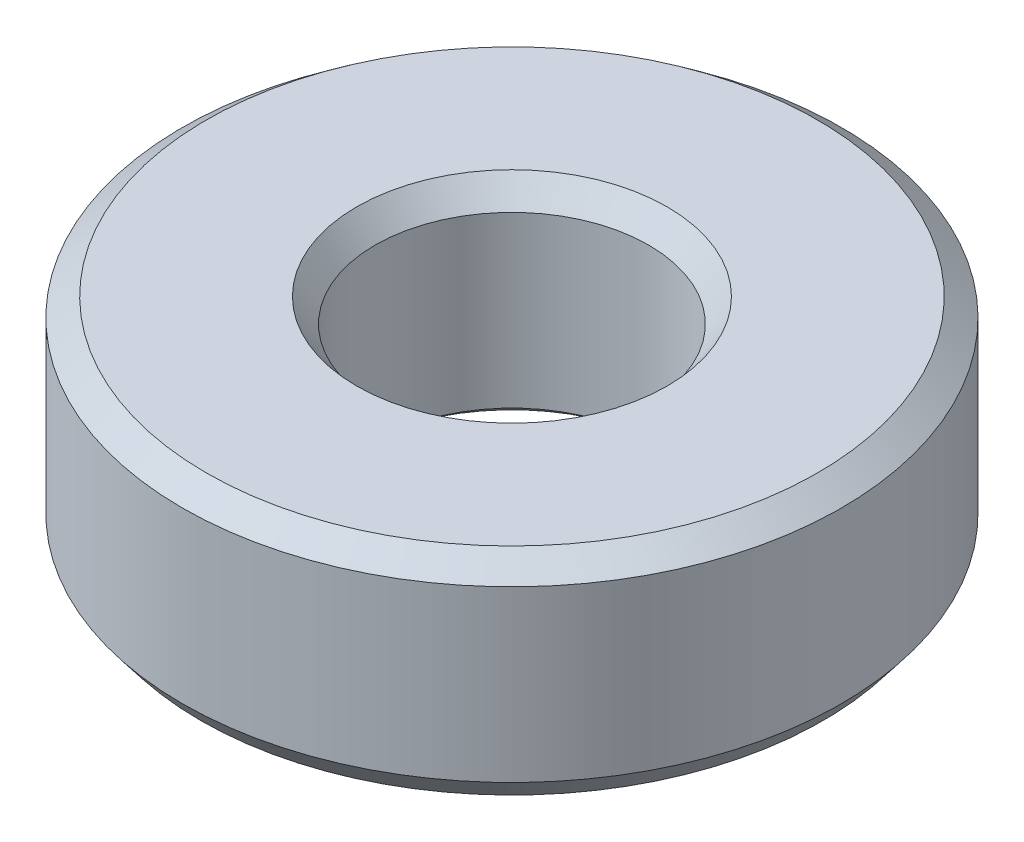
from build123d import *
from OCP.BRepFilletAPI import BRepFilletAPI_MakeChamfer

# Parameters (mm, degrees)
SKETCH1_R           = 17.5
BOSS_EXTRUDE1_DEPTH = 11.24791048
SKETCH2_R           = 7.264637679
CUT_EXTRUDE1_DEPTH  = 28.184839344
CHAMFER1_SIZE       = 0.978509073
CHAMFER1_SIZE2      = 1.269511033


with BuildPart() as part:
    # Sketch1 → Boss-Extrude1 (new body)
    with BuildSketch(Plane(origin=(0, 0, 0), x_dir=(1, 0, 0), z_dir=(0, 1, 0))):
        Circle(SKETCH1_R)
    extrude(amount=BOSS_EXTRUDE1_DEPTH)

    # Sketch2 → Cut-Extrude1 (cut, through all)
    with BuildSketch(Plane(origin=(0, 0, 0), x_dir=(1, 0, 0), z_dir=(0, 1, 0))):
        Circle(SKETCH2_R)
    extrude(amount=CUT_EXTRUDE1_DEPTH, mode=Mode.SUBTRACT)

    # Chamfer1: one chamfer whose edges measure the first distance from different faces: ONE call of the kernel's chamfer builder (chamfer() names one face for all edges)
    chamfer1_edges_1 = [part.edges().sort_by_distance(p)[0] for p in [
        (-7.264637679, 11.24791048, 0),
    ]]
    chamfer1_side_1 = [part.faces().sort_by_distance(p)[0] for p in [
        (-17.005025253, 11.24791048, 0),
    ]]
    chamfer1_edges_2 = [part.edges().sort_by_distance(p)[0] for p in [
        (-7.264637679, 0, 0),
    ]]
    chamfer1_side_2 = [part.faces().sort_by_distance(p)[0] for p in [
        (-7.264637679, 5.62395524, 0),
    ]]
    chamfer1_edges_3 = [part.edges().sort_by_distance(p)[0] for p in [
        (-17.5, 0, 0),
    ]]
    chamfer1_side_3 = [part.faces().sort_by_distance(p)[0] for p in [
        (-17.005025253, 0, 0),
    ]]
    chamfer1_edges_4 = [part.edges().sort_by_distance(p)[0] for p in [
        (-17.5, 11.24791048, 0),
    ]]
    chamfer1_side_4 = [part.faces().sort_by_distance(p)[0] for p in [
        (-17.5, 5.62395524, 0),
    ]]
    chamfer1 = BRepFilletAPI_MakeChamfer(part.part.solid().wrapped)
    for e in chamfer1_edges_1:
        chamfer1.Add(CHAMFER1_SIZE, CHAMFER1_SIZE2, e.wrapped, chamfer1_side_1[0].wrapped)  # the first distance lies on this face
    for e in chamfer1_edges_2:
        chamfer1.Add(CHAMFER1_SIZE, CHAMFER1_SIZE2, e.wrapped, chamfer1_side_2[0].wrapped)  # the first distance lies on this face
    for e in chamfer1_edges_3:
        chamfer1.Add(CHAMFER1_SIZE, CHAMFER1_SIZE2, e.wrapped, chamfer1_side_3[0].wrapped)  # the first distance lies on this face
    for e in chamfer1_edges_4:
        chamfer1.Add(CHAMFER1_SIZE, CHAMFER1_SIZE2, e.wrapped, chamfer1_side_4[0].wrapped)  # the first distance lies on this face
    add(Compound.cast(chamfer1.Shape()), mode=Mode.REPLACE)


solid = part.part
